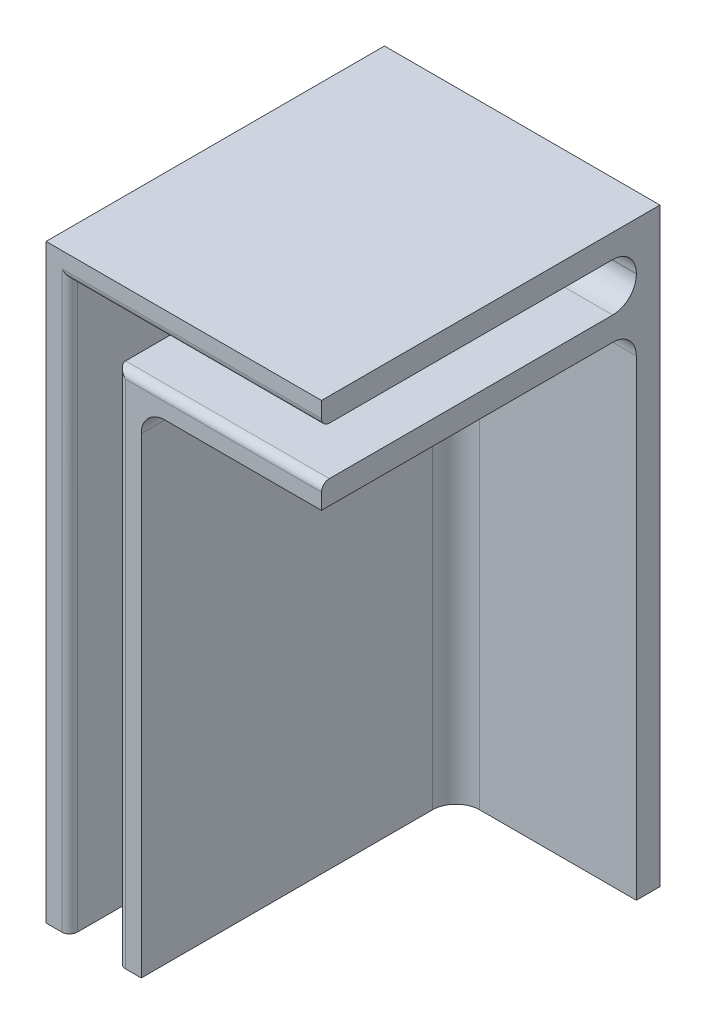
from build123d import *

# Parameters (mm, degrees)
SKETCH1_W           = 35
SKETCH1_H           = 75
BOSS_EXTRUDE1_DEPTH = 3
BOSS_EXTRUDE2_DEPTH = 40
FILLET1_R           = 3
FILLET2_R           = 1


with BuildPart() as part:
    # Sketch1 → Boss-Extrude1 (new body)
    with BuildSketch(Plane.XY):
        with Locations((17.5, 37.5)):
            Rectangle(SKETCH1_W, SKETCH1_H)
    extrude(amount=BOSS_EXTRUDE1_DEPTH)

    # Sketch2 → Boss-Extrude2 (add)
    with BuildSketch(Plane.XY.offset(3)):
        Polygon((35, 65.9), (9.1, 65.9), (9.1, 0), (12.1, 0), (12.1, 62.9), (35, 62.9), align=None)
        Polygon((0, 75), (35, 75), (35, 72), (3, 72), (3, 0), (0, 0), (0, 49), align=None)
    extrude(amount=BOSS_EXTRUDE2_DEPTH)

    # Fillet1
    fillet1_edges = [part.edges().sort_by_distance(p)[0] for p in [
        (22.05, 65.9, 3),
        (19, 72, 3),
        (12.1, 62.9, 23),
        (23.55, 62.9, 3),
        (12.1, 31.45, 3),
        (9.1, 32.95, 3),
        (3, 36, 3),
    ]]
    fillet(fillet1_edges, radius=FILLET1_R)

    # Fillet2
    fillet2_edges = [part.edges().sort_by_distance(p)[0] for p in [
        (3, 36, 43),
        (19, 72, 43),
        (22.05, 65.9, 43),
        (9.1, 32.95, 43),
    ]]
    fillet(fillet2_edges, radius=FILLET2_R)


solid = part.part
